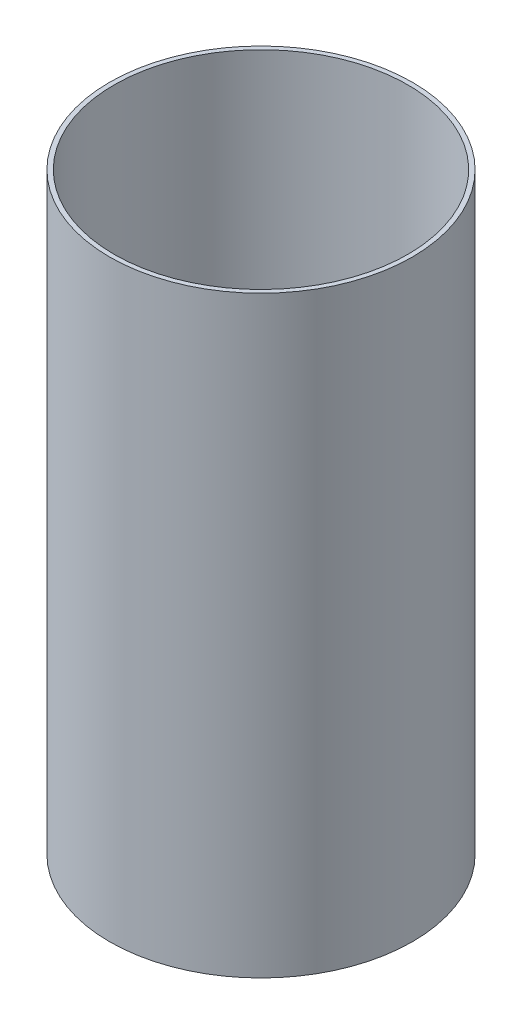
from build123d import *

# Parameters (mm, degrees)
SKETCH1_W = 200
SKETCH1_H = 1.524


with BuildPart() as part:
    # Sketch1 → Revolve1 (revolve)
    with BuildSketch(Plane(origin=(0, 0, 0), x_dir=(0, 1, 0), z_dir=(0, 0, 1))):
        with Locations((1878, 50.292)):
            Rectangle(SKETCH1_W, SKETCH1_H)
    revolve(axis=Axis((0, 1988, 0), (0, -1, 0)))


solid = part.part
